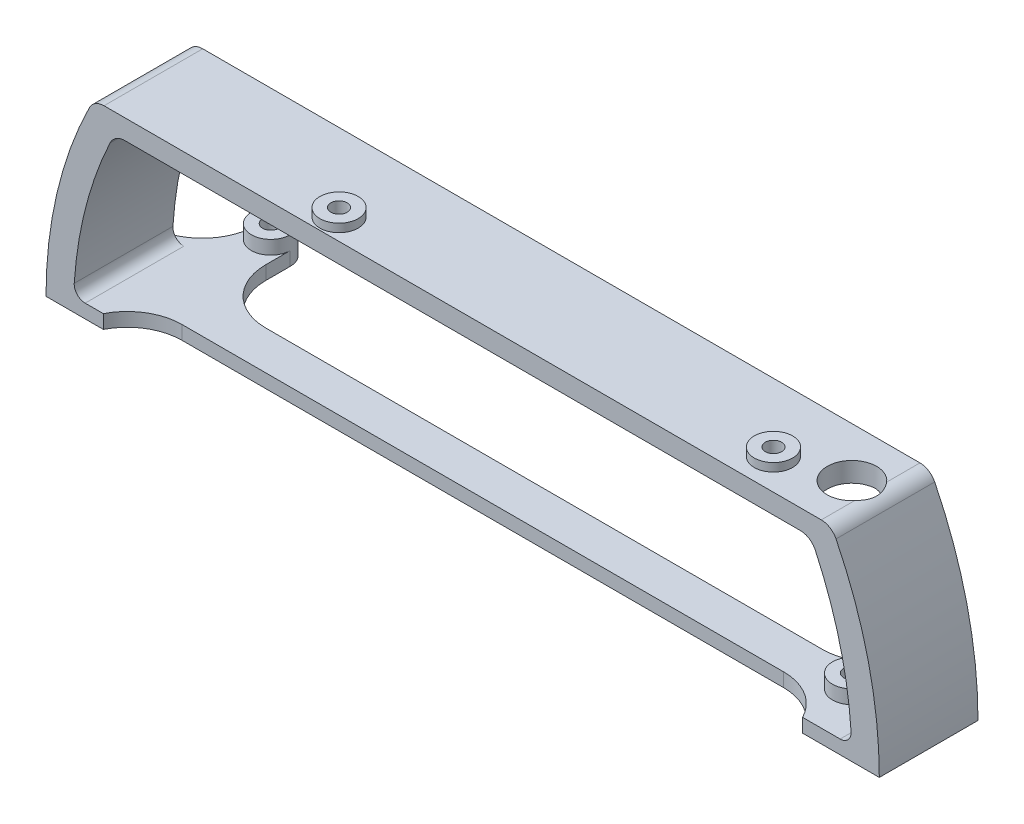
from build123d import *

# Parameters (mm, degrees)
SKETCH1_R                  = 4.5
BOSS_EXTRUDE1_DEPTH        = 6.35
BOSS_EXTRUDE1_2_DEPTH      = 6.35
BOSS_EXTRUDE2_DEPTH        = 3.175
SKETCH5_W                  = 4.5
SKETCH5_H                  = 3.175
BOSS_EXTRUDE3_DEPTH        = 11.43
F_6_CLEARANCE_HOLE1_D      = 3.7973
FILLET1_R                  = 2.54
FILLET2_R                  = 3.81
FILLET3_R                  = 12.7
CUT_EXTRUDE1_REACH         = 111.936
SKETCH10_R                 = 5.715
F_6_CLEARANCE_HOLE2_REACH  = 143.713
F_6_CLEARANCE_HOLE2_BORE_R = 1.89865
BOSS_EXTRUDE5_START        = 1.912
SKETCH13_R                 = 4.43865
SKETCH13_R_2               = 1.89865
BOSS_EXTRUDE5_DEPTH        = 1.912


with BuildPart() as part:
    # Sketch1 → Boss-Extrude1 (new body)
    with BuildSketch(Plane(origin=(0, 0, 0), x_dir=(1, 0, 0), z_dir=(0, 1, 0))):
        with Locations(Location((78.74, 0, 0), (0, 0, 270))):
            Circle(SKETCH1_R)
    extrude(amount=BOSS_EXTRUDE1_DEPTH)



with BuildPart() as body_2:
    # Sketch1 → Boss-Extrude1 2 (new body)
    with BuildSketch(Plane(origin=(0, 0, 0), x_dir=(1, 0, 0), z_dir=(0, 1, 0))):
        with Locations(Location((-78.74, 22.86, 0), (0, 0, 270))):
            Circle(SKETCH1_R)
    extrude(amount=BOSS_EXTRUDE1_2_DEPTH)


with BuildPart() as part_1:
    add(part.part)

    add(body_2.part)  # Boss-Extrude2 merges body 2
    # Sketch2 → Boss-Extrude2 (add)
    with BuildSketch(Plane(origin=(0, 0, 0), x_dir=(1, 0, 0), z_dir=(0, 1, 0))):
        with BuildLine():
            ThreePointArc((-74.24, 22.86), (-78.74, 18.36), (-83.24, 22.86))
            Line((-83.24, 22.86), (-83.24, -4.5))
            Line((-83.24, -4.5), (78.74, -4.5))
            ThreePointArc((78.74, -4.5), (74.24, 0), (78.74, 4.5))
            Line((78.74, 4.5), (-74.24, 4.5))
            Line((-74.24, 4.5), (-74.24, 22.86))
        make_face()
    extrude(amount=BOSS_EXTRUDE2_DEPTH)

    # Sketch5 → Boss-Extrude3 (add, symmetric)
    with BuildSketch(Plane.XY):
        with BuildLine():
            ThreePointArc((-90.114084776, 3.175), (-87.371075104, 22.291795245), (-80.620096155, 40.386))
            Line((-80.620096155, 40.386), (-87.664596069, 40.386))
            ThreePointArc((-87.664596069, 40.386), (-94.280160195, 20.672730678), (-96.52, 0))
            Line((-96.52, 0), (-83.24, 0))
            Line((-83.24, 0), (-83.24, 3.175))
            Line((-83.24, 3.175), (-90.114084776, 3.175))
        make_face()
        with BuildLine():
            Line((80.620096155, 40.386), (87.664596069, 40.386))
            ThreePointArc((87.664596069, 40.386), (86.567546752, 42.686886152), (85.41012022, 44.958))
            Line((85.41012022, 44.958), (78.162696576, 44.958))
            ThreePointArc((78.162696576, 44.958), (79.424301148, 42.689685958), (80.620096155, 40.386))
        make_face()
        with BuildLine():
            Line((-87.664596069, 40.386), (-80.620096155, 40.386))
            ThreePointArc((-80.620096155, 40.386), (-79.424301148, 42.689685958), (-78.162696576, 44.958))
            Line((-78.162696576, 44.958), (-85.41012022, 44.958))
            ThreePointArc((-85.41012022, 44.958), (-86.567546752, 42.686886152), (-87.664596069, 40.386))
        make_face()
        with BuildLine():
            Line((-80.620096155, 40.386), (80.620096155, 40.386))
            ThreePointArc((80.620096155, 40.386), (79.424301148, 42.689685958), (78.162696576, 44.958))
            Line((78.162696576, 44.958), (-78.162696576, 44.958))
            ThreePointArc((-78.162696576, 44.958), (-79.424301148, 42.689685958), (-80.620096155, 40.386))
        make_face()
        with Locations((80.99, 1.5875)):
            Rectangle(SKETCH5_W, SKETCH5_H)
        with BuildLine():
            Line((83.24, 3.175), (83.24, 0))
            Line((83.24, 0), (96.52, 0))
            ThreePointArc((96.52, 0), (94.280160195, 20.672730678), (87.664596069, 40.386))
            Line((87.664596069, 40.386), (80.620096155, 40.386))
            ThreePointArc((80.620096155, 40.386), (87.371075104, 22.291795245), (90.114084776, 3.175))
            Line((90.114084776, 3.175), (83.24, 3.175))
        make_face()
    extrude(amount=BOSS_EXTRUDE3_DEPTH, both=True)

    # #6 Clearance Hole1 (through all)
    with Locations(Plane(origin=(-78.74, 0, -22.86), x_dir=(0, 0, -1), z_dir=(0, -1, 0))):
        with Locations((0, 0), (-22.86, 157.48)):
            Hole(F_6_CLEARANCE_HOLE1_D / 2)

    # Fillet1
    fillet1_edges = [part_1.edges().sort_by_distance(p)[0] for p in [
        (-90.114084776, 3.175, 0),
        (90.114084776, 3.175, 0),
    ]]
    fillet(fillet1_edges, radius=FILLET1_R)

    # Fillet2
    # the kernel refuses this fillet: 3.81 mm, written as the material it adds along each edge
    with BuildSketch(Plane(origin=(80.620096155, 40.386, 5.835732073), x_dir=(-1, 0, 0), z_dir=(0, 0, -1))) as fillet2_piece_1_section:
        with BuildLine():
            CenterArc((2.388096155, -3.81), FILLET2_R, 90, 64.942384582)
            ThreePointArc((-1.06331561, -2.196352941), (-0.539087936, -1.094579337), (0, 0))
            Line((0, 0), (2.388096155, 0))
        make_face()
    fillet2_piece_1 = extrude(amount=17.265732073, mode=Mode.PRIVATE)
    fillet2_piece_1 = fillet2_piece_1 - Plane(origin=(78.74, 40.386, 0), x_dir=(0, 0, 1), z_dir=(0, 1, 0)) * Cylinder(1.89865, 45, mode=Mode.PRIVATE)
    add(fillet2_piece_1)
    with BuildSketch(Plane(origin=(80.620096155, 40.386, 11.43), x_dir=(-1, 0, 0), z_dir=(0, 0, -1))) as fillet2_piece_2_section:
        with BuildLine():
            CenterArc((2.388096155, -3.81), FILLET2_R, 90, 64.942384582)
            ThreePointArc((-1.06331561, -2.196352941), (-0.539087936, -1.094579337), (0, 0))
            Line((0, 0), (2.388096155, 0))
        make_face()
    fillet2_piece_2 = extrude(amount=17.265732073, mode=Mode.PRIVATE)
    fillet2_piece_2 = fillet2_piece_2 - Plane(origin=(78.74, 40.386, 0), x_dir=(0, 0, 1), z_dir=(0, 1, 0)) * Cylinder(1.89865, 45, mode=Mode.PRIVATE)
    add(fillet2_piece_2)
    with BuildSketch(Plane(origin=(-80.620096155, 40.386, -11.43), x_dir=(-0.4357482606496553, -0.900068582576239, 0), z_dir=(0, 0, 1))) as fillet2_piece_3:
        with BuildLine():
            CenterArc((2.388652554, 3.809651194), FILLET2_R, 205.832916425, 64.942384582)
            Line((-1.040608746, 2.149450321), (0, 0))
            ThreePointArc((0, 0), (1.220103103, -0.008255072), (2.440206206, 0))
        make_face()
    extrude(amount=22.86)
    # the kernel refuses this fillet: 3.81 mm, written as the material it takes off along each edge
    with BuildSketch(Plane(origin=(-85.41012022, 44.958, -17.378402089), x_dir=(-0.4548470974381097, -0.8905695469485393, 0), z_dir=(0, 0, 1))) as fillet2_2_piece_1:
        with BuildLine():
            CenterArc((2.332399766, 3.809710574), FILLET2_R, 207.055096642, 63.651134119)
            Line((-1.060670207, 2.076743133), (0, 0))
            ThreePointArc((0, 0), (1.189680418, -0.007332124), (2.379360836, 0))
        make_face()
    extrude(amount=34.756804178, mode=Mode.SUBTRACT)
    with BuildSketch(Plane(origin=(85.41012022, 44.958, 17.378402089), x_dir=(-1, 0, 0), z_dir=(0, 0, -1))) as fillet2_2_piece_2:
        with BuildLine():
            CenterArc((2.331926956, -3.81), FILLET2_R, 90, 63.651134119)
            ThreePointArc((-1.08224537, -2.118986301), (-0.547652451, -1.056158155), (0, 0))
            Line((0, 0), (2.331926956, 0))
        make_face()
    extrude(amount=34.756804178, mode=Mode.SUBTRACT)

    # Fillet3
    # the kernel refuses this fillet: 12.7 mm, written as the material it adds along each edge
    with BuildSketch(Plane(origin=(78.74, 0, -4.5), x_dir=(0, 0, -1), z_dir=(0, 1, 0)), Plane(origin=(-83.24, 0, 4.5), x_dir=(0, 0, 1), z_dir=(0, 1, 0))) as fillet3_piece_1:
        with BuildLine():
            CenterArc((12.7, 11.313580335), FILLET3_R, 180, 62.978120887)
            Line((0, 11.313580335), (0, 0))
            Line((0, 0), (6.93, 0))
        make_face()
    extrude(amount=3.175)
    with BuildSketch(Plane(origin=(78.74, 0, 4.5), x_dir=(0, 0, 1), z_dir=(0, 1, 0))) as fillet3_piece_2:
        with BuildLine():
            CenterArc((12.7, -11.313580335), FILLET3_R, 117.021879113, 62.978120887)
            Line((0, -11.313580335), (0, 0))
            Line((0, 0), (6.93, 0))
        make_face()
    extrude(amount=3.175)
    with BuildSketch(Plane(origin=(-74.24, 0, -4.5), x_dir=(1, 0, 0), z_dir=(0, 1, 0))) as fillet3_piece_3:
        with BuildLine():
            CenterArc((FILLET3_R, FILLET3_R), FILLET3_R, 180, 90)
            Line((0, FILLET3_R), (0, 0))
            Line((0, 0), (FILLET3_R, 0))
        make_face()
    extrude(amount=3.175)
    with BuildSketch(Plane(origin=(-83.24, 0, -11.43), x_dir=(-1, 0, 0), z_dir=(0, 1, 0))) as fillet3_piece_4:
        with BuildLine():
            CenterArc((12.636340451, -12.7), FILLET3_R, 90, 84.260829523)
            Line((0, -11.43), (0, 0))
            Line((0, 0), (12.636340451, 0))
        make_face()
    extrude(amount=3.175)

    # Cut-Extrude1: up to this face of the body (flat: up to its plane)
    cut_extrude1_end = Plane(part_1.part.faces().sort_by_distance((78.74, 6.35, -4.372720779))[0])
    # Sketch10 → Cut-Extrude1 (cut, up to the picked face)
    with BuildSketch(Plane(origin=(0, 44.958, 0), x_dir=(1, 0, 0), z_dir=(0, 1, 0)), mode=Mode.PRIVATE) as cut_extrude1_sk1:
        with Locations(Location((78.74, 0, 0), (0, 0, 95.099688914))):
            Circle(SKETCH10_R)
    cut_extrude1_tool1 = split(extrude(cut_extrude1_sk1.sketch, amount=-CUT_EXTRUDE1_REACH, mode=Mode.PRIVATE), bisect_by=cut_extrude1_end, keep=Keep.BOTH, mode=Mode.PRIVATE)
    add(cut_extrude1_tool1.solids().sort_by(Axis((78.74, 44.958, 0), (0, -1, 0)))[0], mode=Mode.SUBTRACT)

    # #6 Clearance Hole2 bore (on position points) → #6 Clearance Hole2 (cut, up to next)
    with BuildSketch(Plane(origin=(-33.5265, 44.958, 6.5405), x_dir=(1, 0, 0), z_dir=(0, 1, 0)), mode=Mode.PRIVATE) as f_6_clearance_hole2_sk1:
        Circle(F_6_CLEARANCE_HOLE2_BORE_R)
    f_6_clearance_hole2_tool1 = extrude(f_6_clearance_hole2_sk1.sketch, amount=-F_6_CLEARANCE_HOLE2_REACH, mode=Mode.PRIVATE) & part_1.part
    # #6 Clearance Hole2 bore (on position points) → #6 Clearance Hole2 (cut, up to next)
    with BuildSketch(Plane(origin=(-33.5265, 44.958, 6.5405), x_dir=(1, 0, 0), z_dir=(0, 1, 0)), mode=Mode.PRIVATE) as f_6_clearance_hole2_sk2:
        with Locations((98.3488, 2.286)):
            Circle(F_6_CLEARANCE_HOLE2_BORE_R)
    f_6_clearance_hole2_tool2 = extrude(f_6_clearance_hole2_sk2.sketch, amount=-F_6_CLEARANCE_HOLE2_REACH, mode=Mode.PRIVATE) & part_1.part
    add(f_6_clearance_hole2_tool1.solids().sort_by_distance((-33.5265, 44.958, 6.5405))[0], mode=Mode.SUBTRACT)
    add(f_6_clearance_hole2_tool2.solids().sort_by_distance((64.8223, 44.958, 4.2545))[0], mode=Mode.SUBTRACT)

    # Sketch13 → Boss-Extrude5 (add)
    # profile 1 of 2: a face of its own
    with BuildSketch(Plane(origin=(0, 44.958, 0), x_dir=(1, 0, 0), z_dir=(0, 1, 0)).offset(BOSS_EXTRUDE5_START)):
        with Locations(Location((-33.5265, -6.5405, 0), (0, 0, 180))):
            Circle(SKETCH13_R)
        with Locations(Location((-33.5265, -6.5405, 0), (0, 0, 180))):
            Circle(SKETCH13_R_2, mode=Mode.SUBTRACT)
    # profile 2 of 2: a face of its own
    with BuildSketch(Plane(origin=(0, 44.958, 0), x_dir=(1, 0, 0), z_dir=(0, 1, 0)).offset(BOSS_EXTRUDE5_START)):
        with Locations(Location((64.8223, -4.2545, 0), (0, 0, 180))):
            Circle(SKETCH13_R)
        with Locations(Location((64.8223, -4.2545, 0), (0, 0, 180))):
            Circle(SKETCH13_R_2, mode=Mode.SUBTRACT)
    extrude(amount=-BOSS_EXTRUDE5_DEPTH)


solid = part_1.part
